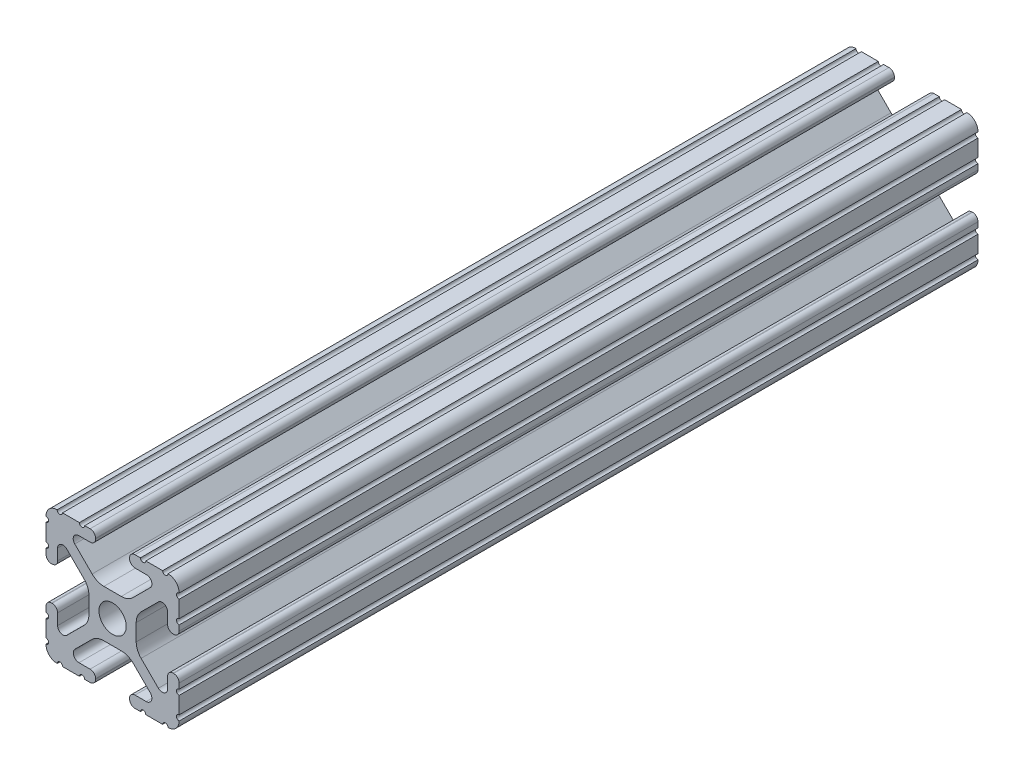
from build123d import *

# Parameters (mm, degrees)
SKETCH1_R               = 2.6035
BOSS_EXTRUDE1_DEPTH     = 76.2
CUT_EXTRUDE1_DEPTH      = 79.288057838
CUT_EXTRUDE1_DEPTH_BACK = 79.288057838
SKETCH2_R               = 3.175
CUT_EXTRUDE2_DEPTH      = 79.288057935
CUT_EXTRUDE2_DEPTH_BACK = 79.288057935
SKETCH4_R               = 3.175


with BuildPart() as part:
    # Sketch1 → Boss-Extrude1 (new, symmetric)
    with BuildSketch(Plane.XY):
        with BuildLine():
            Line((-7.179650497, -8.645192506), (-3.952270251, -5.423690499))
            ThreePointArc((-3.952270251, -5.423690499), (-2.922936451, -4.736929036), (-1.709253557, -4.4958))
            Line((-1.709253557, -4.4958), (1.709253557, -4.4958))
            ThreePointArc((1.709253557, -4.4958), (2.922936451, -4.736929036), (3.952270251, -5.423690499))
            Line((3.952270251, -5.423690499), (7.179650497, -8.645192506))
            ThreePointArc((7.179650497, -8.645192506), (7.41473083, -9.822813117), (6.416408329, -10.4902))
            Line((6.416408329, -10.4902), (4.287512407, -10.4902))
            ThreePointArc((4.287512407, -10.4902), (3.54574862, -10.79744862), (3.2385, -11.539212407))
            Line((3.2385, -11.539212407), (3.2385, -11.650987593))
            ThreePointArc((3.2385, -11.650987593), (3.54574862, -12.39275138), (4.287512407, -12.7))
            Line((4.287512407, -12.7), (5.317126718, -12.7))
            ThreePointArc((5.317126718, -12.7), (5.825126718, -12.192), (6.333126718, -12.7))
            Line((6.333126718, -12.7), (9.550443118, -12.7))
            ThreePointArc((9.550443118, -12.7), (10.058366869, -12.192000006), (10.566443095, -12.699847501))
            ThreePointArc((10.566443095, -12.699847501), (12.082537762, -12.08250727), (12.699846982, -10.566399977))
            ThreePointArc((12.699846982, -10.566399977), (12.192000006, -10.058323491), (12.7, -9.5504))
            Line((12.7, -9.5504), (12.7, -6.3330836))
            ThreePointArc((12.7, -6.3330836), (12.192, -5.8250836), (12.7, -5.3170836))
            Line((12.7, -5.3170836), (12.7, -4.287469289))
            ThreePointArc((12.7, -4.287469289), (12.39275138, -3.545705502), (11.650987593, -3.238456882))
            Line((11.650987593, -3.238456882), (11.539212407, -3.238456882))
            ThreePointArc((11.539212407, -3.238456882), (10.79744862, -3.545705502), (10.4902, -4.287469289))
            Line((10.4902, -4.287469289), (10.4902, -6.402089023))
            ThreePointArc((10.4902, -6.402089023), (9.856505071, -7.351067942), (8.737131347, -7.129408934))
            Line((8.737131347, -7.129408934), (5.441005833, -3.840816462))
            ThreePointArc((5.441005833, -3.840816462), (4.750877967, -2.809883091), (4.5085, -1.593185507))
            Line((4.5085, -1.593185507), (4.5085, 1.593185507))
            ThreePointArc((4.5085, 1.593185507), (4.750877967, 2.809883091), (5.441005833, 3.840816462))
            Line((5.441005833, 3.840816462), (8.737131347, 7.129408934))
            ThreePointArc((8.737131347, 7.129408934), (9.856505071, 7.351067942), (10.4902, 6.402089023))
            Line((10.4902, 6.402089023), (10.4902, 4.287469289))
            ThreePointArc((10.4902, 4.287469289), (10.79744862, 3.545705502), (11.539212407, 3.238456882))
            Line((11.539212407, 3.238456882), (11.650987593, 3.238456882))
            ThreePointArc((11.650987593, 3.238456882), (12.39275138, 3.545705502), (12.7, 4.287469289))
            Line((12.7, 4.287469289), (12.7, 5.3170836))
            ThreePointArc((12.7, 5.3170836), (12.192, 5.8250836), (12.7, 6.3330836))
            Line((12.7, 6.3330836), (12.7, 9.5504))
            ThreePointArc((12.7, 9.5504), (12.192000006, 10.058323491), (12.699846982, 10.566399977))
            ThreePointArc((12.699846982, 10.566399977), (12.082537762, 12.08250727), (10.566443095, 12.699847501))
            ThreePointArc((10.566443095, 12.699847501), (10.058366869, 12.192000006), (9.550443118, 12.7))
            Line((9.550443118, 12.7), (6.333126718, 12.7))
            ThreePointArc((6.333126718, 12.7), (5.825126718, 12.192), (5.317126718, 12.7))
            Line((5.317126718, 12.7), (4.287512407, 12.7))
            ThreePointArc((4.287512407, 12.7), (3.54574862, 12.39275138), (3.2385, 11.650987593))
            Line((3.2385, 11.650987593), (3.2385, 11.539212407))
            ThreePointArc((3.2385, 11.539212407), (3.54574862, 10.79744862), (4.287512407, 10.4902))
            Line((4.287512407, 10.4902), (6.476788598, 10.4902))
            ThreePointArc((6.476788598, 10.4902), (7.432222385, 9.85140422), (7.207036008, 8.724370562))
            Line((7.207036008, 8.724370562), (3.898272566, 5.423169045))
            ThreePointArc((3.898272566, 5.423169045), (2.869120213, 4.736787962), (1.655778399, 4.4958))
            Line((1.655778399, 4.4958), (-1.655778399, 4.4958))
            ThreePointArc((-1.655778399, 4.4958), (-2.869120213, 4.736787962), (-3.898272566, 5.423169045))
            Line((-3.898272566, 5.423169045), (-7.207036008, 8.724370562))
            ThreePointArc((-7.207036008, 8.724370562), (-7.432222385, 9.85140422), (-6.476788598, 10.4902))
            Line((-6.476788598, 10.4902), (-4.287512407, 10.4902))
            ThreePointArc((-4.287512407, 10.4902), (-3.54574862, 10.79744862), (-3.2385, 11.539212407))
            Line((-3.2385, 11.539212407), (-3.2385, 11.650987593))
            ThreePointArc((-3.2385, 11.650987593), (-3.54574862, 12.39275138), (-4.287512407, 12.7))
            Line((-4.287512407, 12.7), (-5.317126718, 12.7))
            ThreePointArc((-5.317126718, 12.7), (-5.825126718, 12.192), (-6.333126718, 12.7))
            Line((-6.333126718, 12.7), (-9.550443118, 12.7))
            ThreePointArc((-9.550443118, 12.7), (-10.058366869, 12.192000006), (-10.566443095, 12.699847501))
            ThreePointArc((-10.566443095, 12.699847501), (-12.082537762, 12.08250727), (-12.699846982, 10.566399977))
            ThreePointArc((-12.699846982, 10.566399977), (-12.192000006, 10.058323491), (-12.7, 9.5504))
            Line((-12.7, 9.5504), (-12.7, 6.3330836))
            ThreePointArc((-12.7, 6.3330836), (-12.192, 5.8250836), (-12.7, 5.3170836))
            Line((-12.7, 5.3170836), (-12.7, 4.287469289))
            ThreePointArc((-12.7, 4.287469289), (-12.39275138, 3.545705502), (-11.650987593, 3.238456882))
            Line((-11.650987593, 3.238456882), (-11.539212407, 3.238456882))
            ThreePointArc((-11.539212407, 3.238456882), (-10.79744862, 3.545705502), (-10.4902, 4.287469289))
            Line((-10.4902, 4.287469289), (-10.4902, 6.402089023))
            ThreePointArc((-10.4902, 6.402089023), (-9.856505071, 7.351067942), (-8.737131347, 7.129408934))
            Line((-8.737131347, 7.129408934), (-5.441005833, 3.840816462))
            ThreePointArc((-5.441005833, 3.840816462), (-4.750877967, 2.809883091), (-4.5085, 1.593185507))
            Line((-4.5085, 1.593185507), (-4.5085, -1.593185507))
            ThreePointArc((-4.5085, -1.593185507), (-4.750877967, -2.809883091), (-5.441005833, -3.840816462))
            Line((-5.441005833, -3.840816462), (-8.737131347, -7.129408934))
            ThreePointArc((-8.737131347, -7.129408934), (-9.856505071, -7.351067942), (-10.4902, -6.402089023))
            Line((-10.4902, -6.402089023), (-10.4902, -4.287469289))
            ThreePointArc((-10.4902, -4.287469289), (-10.79744862, -3.545705502), (-11.539212407, -3.238456882))
            Line((-11.539212407, -3.238456882), (-11.650987593, -3.238456882))
            ThreePointArc((-11.650987593, -3.238456882), (-12.39275138, -3.545705502), (-12.7, -4.287469289))
            Line((-12.7, -4.287469289), (-12.7, -5.3170836))
            ThreePointArc((-12.7, -5.3170836), (-12.192, -5.8250836), (-12.7, -6.3330836))
            Line((-12.7, -6.3330836), (-12.7, -9.5504))
            ThreePointArc((-12.7, -9.5504), (-12.192000006, -10.058323491), (-12.699846982, -10.566399977))
            ThreePointArc((-12.699846982, -10.566399977), (-12.082537762, -12.08250727), (-10.566443095, -12.699847501))
            ThreePointArc((-10.566443095, -12.699847501), (-10.058366869, -12.192000006), (-9.550443118, -12.7))
            Line((-9.550443118, -12.7), (-6.333126718, -12.7))
            ThreePointArc((-6.333126718, -12.7), (-5.825126718, -12.192), (-5.317126718, -12.7))
            Line((-5.317126718, -12.7), (-4.287512407, -12.7))
            ThreePointArc((-4.287512407, -12.7), (-3.54574862, -12.39275138), (-3.2385, -11.650987593))
            Line((-3.2385, -11.650987593), (-3.2385, -11.539212407))
            ThreePointArc((-3.2385, -11.539212407), (-3.54574862, -10.79744862), (-4.287512407, -10.4902))
            Line((-4.287512407, -10.4902), (-6.416408329, -10.4902))
            ThreePointArc((-6.416408329, -10.4902), (-7.41473083, -9.822813117), (-7.179650497, -8.645192506))
        make_face()
        Circle(SKETCH1_R, mode=Mode.SUBTRACT)
    extrude(amount=BOSS_EXTRUDE1_DEPTH, both=True)

    # Sketch2 → Cut-Extrude1 (cut, two sides: drawn at the far end of the back side and taken through both)
    with BuildSketch(Plane(origin=(0, 0, 0), x_dir=(1, 0, 0), z_dir=(0, 1, 0)).offset(-CUT_EXTRUDE1_DEPTH_BACK)):
        with Locations((0, 63.5)):
            Circle(SKETCH2_R)
        with Locations((0, -63.5)):
            Circle(SKETCH2_R)
    extrude(amount=CUT_EXTRUDE1_DEPTH + CUT_EXTRUDE1_DEPTH_BACK, mode=Mode.SUBTRACT)

    # Sketch4 → Cut-Extrude2 (cut, two sides: drawn at the far end of the back side and taken through both)
    with BuildSketch(Plane(origin=(0, 0, 0), x_dir=(0, 0, -1), z_dir=(1, 0, 0)).offset(-CUT_EXTRUDE2_DEPTH_BACK)):
        with Locations((25.4, 0)):
            Circle(SKETCH4_R)
        Circle(SKETCH4_R)
    extrude(amount=CUT_EXTRUDE2_DEPTH + CUT_EXTRUDE2_DEPTH_BACK, mode=Mode.SUBTRACT)


solid = part.part
